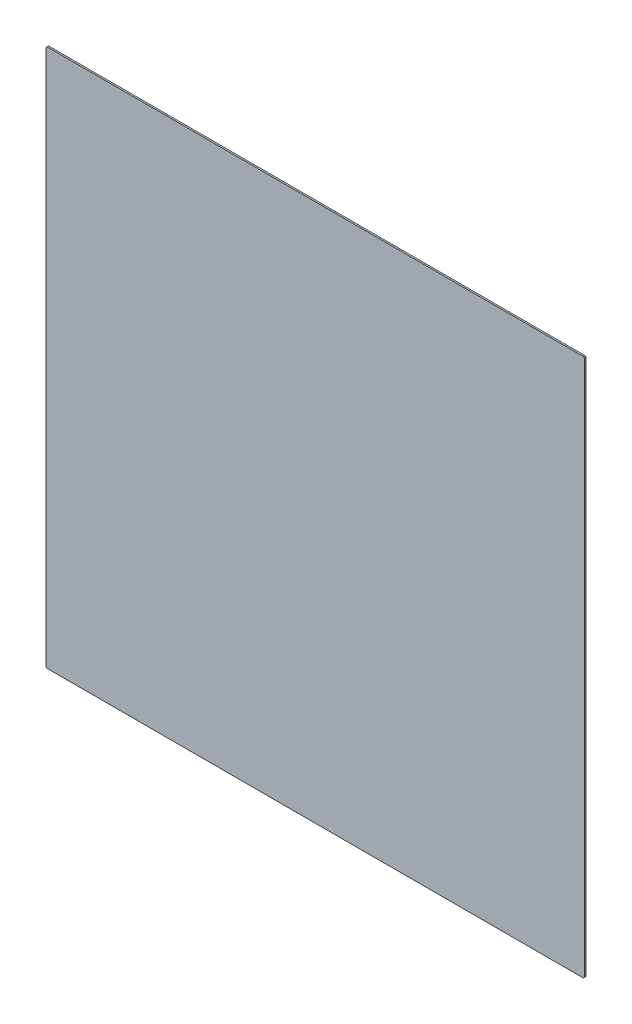
from build123d import *

# Parameters (mm, degrees)
SKETCH_1_W             = 1040
SKETCH_1_H             = 1040
SM_BASE_FLANGE_1_DEPTH = 3
CHAMFER_1_SIZE         = 2


# Sheet-metal steps are written as plain solids
with BuildPart() as part:
    # Sketch 1 → 基体-法兰1 (new body)
    with BuildSketch(Plane.XY):
        Rectangle(SKETCH_1_W, SKETCH_1_H)
    extrude(amount=-SM_BASE_FLANGE_1_DEPTH)

    # 倒角1
    chamfer_1_edges = [part.edges().sort_by_distance(p)[0] for p in [
        (520, -520, -1.5),
        (-520, -520, -1.5),
        (-520, 520, -1.5),
        (520, 520, -1.5),
    ]]
    chamfer(chamfer_1_edges, length=CHAMFER_1_SIZE)


solid = part.part
